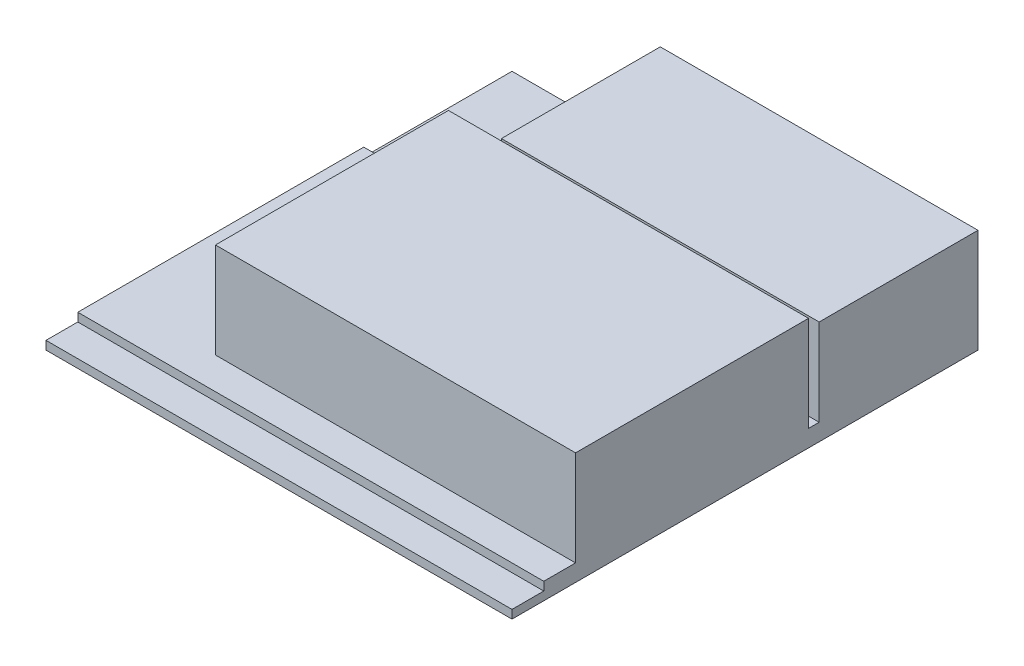
from build123d import *

# Parameters (mm, degrees)
SKETCH1_W           = 220
SKETCH1_H           = 220
BOSS_EXTRUDE1_DEPTH = 4
SKETCH2_W           = 220
SKETCH2_H           = 135
BOSS_EXTRUDE2_DEPTH = 4
SKETCH3_W           = 150
SKETCH3_H           = 75
BOSS_EXTRUDE3_DEPTH = 45
SKETCH4_W           = 170
SKETCH4_H           = 110
BOSS_EXTRUDE4_DEPTH = 45


with BuildPart() as part:
    # Sketch1 → Boss-Extrude1 (new body)
    with BuildSketch(Plane(origin=(0, 0, 0), x_dir=(1, 0, 0), z_dir=(0, 1, 0))):
        with Locations((-18.301886792, -38.490566038)):
            Rectangle(SKETCH1_W, SKETCH1_H)
    extrude(amount=BOSS_EXTRUDE1_DEPTH)

    # Sketch2 → Boss-Extrude2 (add)
    with BuildSketch(Plane(origin=(0, 4, 0), x_dir=(1, 0, 0), z_dir=(0, 1, 0))):
        with Locations((-18.301886792, -65.990566038)):
            Rectangle(SKETCH2_W, SKETCH2_H)
    extrude(amount=BOSS_EXTRUDE2_DEPTH)

    # Sketch3 → Boss-Extrude3 (add)
    with BuildSketch(Plane(origin=(0, 4, 0), x_dir=(1, 0, 0), z_dir=(0, 1, 0))):
        with Locations((16.698113208, 34.009433962)):
            Rectangle(SKETCH3_W, SKETCH3_H)
    extrude(amount=BOSS_EXTRUDE3_DEPTH)

    # Sketch4 → Boss-Extrude4 (add)
    with BuildSketch(Plane(origin=(0, 8, 0), x_dir=(1, 0, 0), z_dir=(0, 1, 0))):
        with Locations((6.698113208, -63.490566038)):
            Rectangle(SKETCH4_W, SKETCH4_H)
    extrude(amount=BOSS_EXTRUDE4_DEPTH)


solid = part.part
